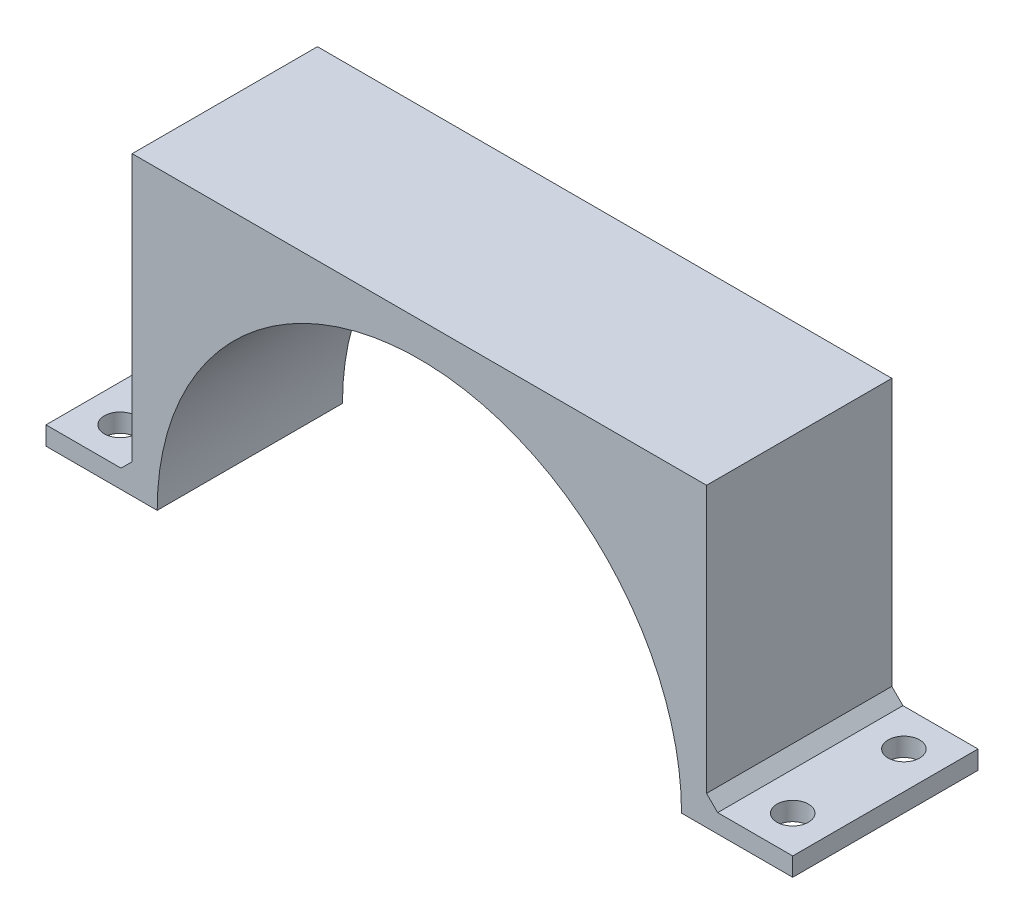
from build123d import *

# Parameters (mm, degrees)
DODANIE_WYCI_GNI_CIE1_DEPTH = 50
SZKIC2_R                    = 4.25
WYTNIJ_WYCI_GNI_CIE1_DEPTH  = 50
SFAZOWANIE1_SIZE            = 3
SFAZOWANIE2_SIZE            = 3


with BuildPart() as part:
    # Szkic1 → Dodanie-wyciągnięcie1 (new body)
    with BuildSketch(Plane.XY):
        with BuildLine():
            Line((70.75, 0), (100.75, 0))
            Line((100.75, 0), (100.75, 5))
            Line((100.75, 5), (77.5, 5))
            Line((77.5, 5), (77.5, 80))
            Line((77.5, 80), (-77.5, 80))
            Line((-77.5, 80), (-77.5, 5))
            Line((-77.5, 5), (-100.75, 5))
            Line((-100.75, 5), (-100.75, 0))
            Line((-100.75, 0), (-70.75, 0))
            ThreePointArc((-70.75, 0), (0, 70.75), (70.75, 0))
        make_face()
    extrude(amount=DODANIE_WYCI_GNI_CIE1_DEPTH)

    # Szkic2 → Wytnij-wyciągnięcie1 (cut)
    with BuildSketch(Plane(origin=(0, 5, 0), x_dir=(1, 0, 0), z_dir=(0, 1, 0))):
        with Locations((-90.75, -10)):
            Circle(SZKIC2_R)
        with Locations((-90.75, -40)):
            Circle(SZKIC2_R)
    wytnij_wyci_gni_cie1 = extrude(amount=-WYTNIJ_WYCI_GNI_CIE1_DEPTH, mode=Mode.SUBTRACT)

    # Lustro1: Wytnij-wyciągnięcie1 across plane
    add(wytnij_wyci_gni_cie1.mirror(Plane(origin=(0, 0, 0), x_dir=(0, 0, 1), z_dir=(1, 0, 0))), mode=Mode.SUBTRACT)

    # Sfazowanie1
    sfazowanie1_edges = [part.edges().sort_by_distance(p)[0] for p in [
        (77.5, 5, 25),
    ]]
    chamfer(sfazowanie1_edges, length=SFAZOWANIE1_SIZE)

    # Sfazowanie2
    sfazowanie2_edges = [part.edges().sort_by_distance(p)[0] for p in [
        (-77.5, 5, 25),
    ]]
    chamfer(sfazowanie2_edges, length=SFAZOWANIE2_SIZE)


solid = part.part
